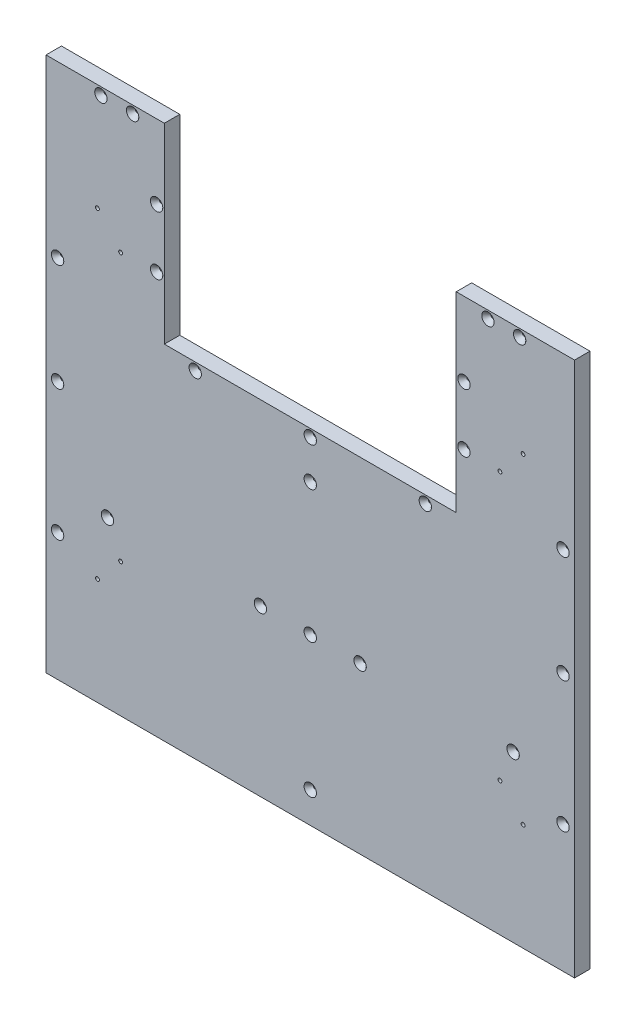
from build123d import *

# Parameters (mm, degrees)
BOSS_EXTRUDE1_DEPTH = 12.7
HOLE1_D             = 3.175
HOLE1_DEPTH         = 31.75
HOLE1_CSINK_D       = 10.16
HOLE1_CSINK_ANGLE   = 82
HOLE1_TIP           = 0.953866233
HOLE2_D             = 3.175
HOLE2_DEPTH         = 31.75
HOLE2_CSINK_D       = 10.16
HOLE2_CSINK_ANGLE   = 82
HOLE2_TIP           = 0.953866233


with BuildPart() as part:
    # Sketch1 → Boss-Extrude1 (new body)
    with BuildSketch(Plane.XY):
        Polygon((341.304465963, 12.7), (244.004465963, 12.7), (244.004465963, -144.6), (124.004465969, -144.6), (124.004465969, -427.342121692), (341.304465963, -427.342121692), align=None)
    boss_extrude1 = extrude(amount=BOSS_EXTRUDE1_DEPTH)

    # Mirror1: Boss-Extrude1 across plane
    add(boss_extrude1.mirror(Plane(origin=(124.004465969, -144.6, 12.7), x_dir=(0, 0, 1), z_dir=(1, 0, 0))))

    # Hole1
    with Locations(Plane(origin=(124.004465969, 10.424290059, 12.7), x_dir=(-1, 0, 0), z_dir=(0, 0, 1))):
        with Locations((-207.774999994, 333.02141023), (-207.774999994, 225.48903684), (-207.774999994, 137.424290059), (-172.166666661, 4.074290059), (-146.083333327, 4.074290059), (-94.599999994, 161.374290059), (0, 161.374290059), (94.599999994, 161.374290059), (146.083333327, 4.074290059), (172.166666661, 4.074290059), (207.774999994, 137.424290059), (207.774999994, 225.48903684), (207.774999994, 333.02141023), (166.795833328, 301.970350905), (40.979166666, 301.970350905), (-40.979166666, 301.970350905), (-166.795833328, 301.970350905), (0, 193.124290059), (0, 301.970350905), (0, 412.366411751), (-126.349999994, 106.824290059), (-126.349999994, 58.624290059), (126.349999994, 58.624290059), (126.349999994, 106.824290059)):
            CounterSinkHole(HOLE1_D / 2, HOLE1_CSINK_D / 2, depth=HOLE1_DEPTH, counter_sink_angle=HOLE1_CSINK_ANGLE)
            with Locations((0, 0, -(HOLE1_DEPTH + HOLE1_TIP / 2))):  # 118° drill point
                Cone(0, HOLE1_D / 2, HOLE1_TIP, mode=Mode.SUBTRACT)

    # Hole2
    with Locations(Plane(origin=(124.004465969, 10.424290059, 0), x_dir=(1, 0, 0), z_dir=(0, 0, -1))):
        with Locations((-155.949999994, 107.734820482), (155.949999994, 107.734820482), (155.949999994, 327.755881328), (174.999999994, 85.732714397), (174.999999994, 349.757987412), (-174.999999994, 349.757987412), (-174.999999994, 85.732714397), (-155.949999994, 327.755881328)):
            CounterSinkHole(HOLE2_D / 2, HOLE2_CSINK_D / 2, depth=HOLE2_DEPTH, counter_sink_angle=HOLE2_CSINK_ANGLE)
            with Locations((0, 0, -(HOLE2_DEPTH + HOLE2_TIP / 2))):  # 118° drill point
                Cone(0, HOLE2_D / 2, HOLE2_TIP, mode=Mode.SUBTRACT)


solid = part.part
